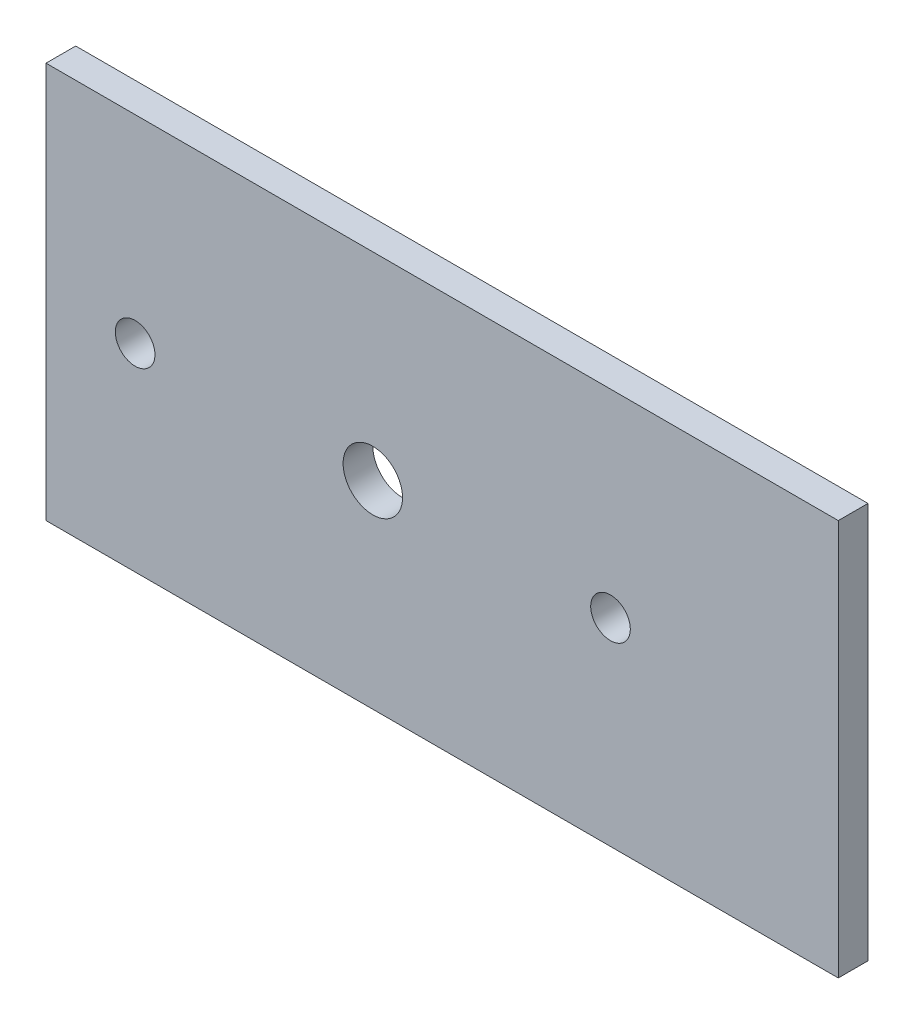
from build123d import *

# Parameters (mm, degrees)
SKETCH1_W           = 80
SKETCH1_H           = 40
BOSS_EXTRUDE1_DEPTH = 3
SKETCH2_R           = 2
SKETCH2_R_2         = 3
CUT_EXTRUDE1_DEPTH  = 90.493016487


with BuildPart() as part:
    # Sketch1 → Boss-Extrude1 (new body)
    with BuildSketch(Plane.XY):
        with Locations((40, 20)):
            Rectangle(SKETCH1_W, SKETCH1_H)
    extrude(amount=BOSS_EXTRUDE1_DEPTH)

    # Sketch2 → Cut-Extrude1 (cut, through all)
    with BuildSketch(Plane.XY.offset(3)):
        with Locations((9, 20)):
            Circle(SKETCH2_R)
        with Locations((57, 20)):
            Circle(SKETCH2_R)
        with Locations((33, 20)):
            Circle(SKETCH2_R_2)
    extrude(amount=-CUT_EXTRUDE1_DEPTH, mode=Mode.SUBTRACT)


solid = part.part
